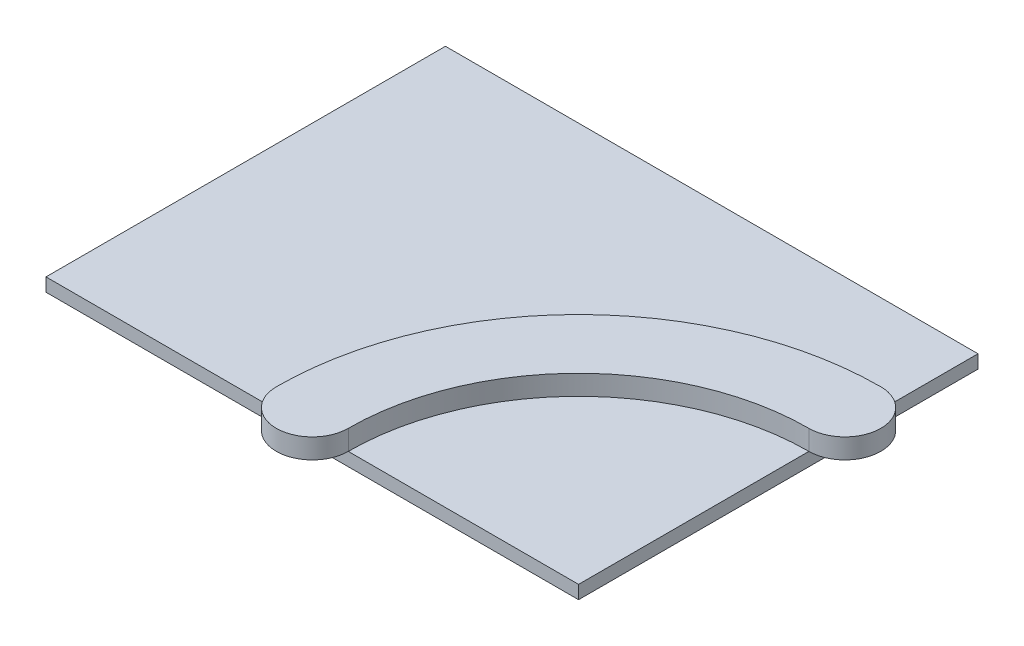
from build123d import *

# Parameters (mm, degrees)
SKETCH2_W           = 400
SKETCH2_H           = 300
BOSS_EXTRUDE1_DEPTH = 10
BOSS_EXTRUDE2_DEPTH = 15


with BuildPart() as part:
    # Sketch2 → Boss-Extrude1 (new body)
    with BuildSketch(Plane(origin=(0, 0, 0), x_dir=(1, 0, 0), z_dir=(0, 1, 0))):
        with Locations((-200, 150)):
            Rectangle(SKETCH2_W, SKETCH2_H)
    extrude(amount=BOSS_EXTRUDE1_DEPTH)


with BuildPart() as body_2:
    # Sketch3 → Boss-Extrude2 (new body)
    with BuildSketch(Plane(origin=(0, 10, 0), x_dir=(1, 0, 0), z_dir=(0, 1, 0))):
        with BuildLine():
            ThreePointArc((0, 227.019605869), (-160.527102772, 160.527102772), (-227.019605869, 0))
            ThreePointArc((-227.019605869, 0), (-200, -27.019605869), (-172.980394131, 0))
            ThreePointArc((-172.980394131, 0), (-122.315609702, 122.315609702), (0, 172.980394131))
            ThreePointArc((0, 172.980394131), (27.019605869, 200), (0, 227.019605869))
        make_face()
    extrude(amount=BOSS_EXTRUDE2_DEPTH)


solid = Compound([part.part, body_2.part])
